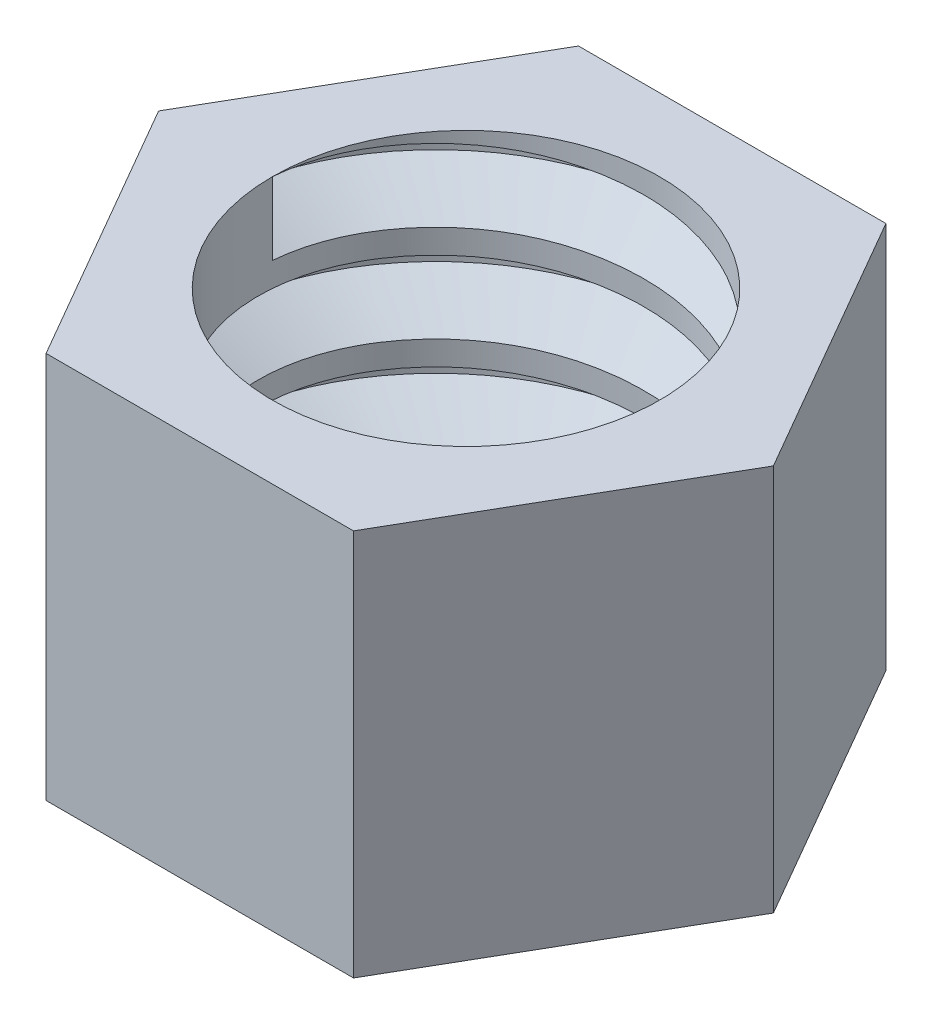
from build123d import *

# Parameters (mm, degrees)
SKETCH1_R           = 2.54
BOSS_EXTRUDE1_DEPTH = 2.54
THREAD2_PITCH       = 1.27


with BuildPart() as part:
    # Sketch1 → Boss-Extrude1 (new, symmetric)
    with BuildSketch(Plane(origin=(0, 0, 0), x_dir=(1, 0, 0), z_dir=(0, 1, 0))):
        Polygon((2.016395815, -3.4925), (4.03279163, 0), (2.016395815, 3.4925), (-2.016395815, 3.4925), (-4.03279163, 0), (-2.016395815, -3.4925), align=None)
        with Locations(Location((0, 0, 0), (0, 0, 270))):
            Circle(SKETCH1_R, mode=Mode.SUBTRACT)
    extrude(amount=BOSS_EXTRUDE1_DEPTH, both=True)

    # Thread2: the profile of Thread Profile2 profile screwed along a right-hand helix of 7.874016 turns, 8 arcs to a turn; built about Z, then put on its axis
    thread2_z = Axis((0, 0, 0), (0, 0, 1))
    thread2_corners = [(2.5397, 0, -0.000173205), (3.227407661, 0, 0.396874998), (3.227407661, 0, 0.555624998), (2.5397, 0, 0.952673202)]
    with BuildLine(mode=Mode.PRIVATE) as thread2_profile:
        Line(thread2_corners[0], thread2_corners[1])
        Line(thread2_corners[1], thread2_corners[2])
        Line(thread2_corners[2], thread2_corners[3])
        Line(thread2_corners[3], thread2_corners[0])
    thread2_cap = Face(thread2_profile.wire())
    thread2_turn_angles = [0, 22.5, 45, 67.5, 90, 112.5, 135, 157.5, 180, 202.5, 225, 247.5, 270, 292.5, 315, 337.5, 360]
    thread2_turn_weights = [1, 0.9238795325112867, 1, 0.9238795325112867, 1, 0.9238795325112867, 1, 0.9238795325112867, 1, 0.9238795325112867, 1, 0.9238795325112867, 1, 0.9238795325112867, 1, 0.9238795325112867, 1]
    thread2_turn_rails = [Edge.make_bspline([Vector(p[0], p[1], 0).rotate(thread2_z, thread2_turn_angles[k]) / thread2_turn_weights[k] + Vector(0, 0, p[2] + THREAD2_PITCH * thread2_turn_angles[k] / 360) for k in range(17)], [0, 0, 0, 1, 1, 2, 2, 3, 3, 4, 4, 5, 5, 6, 6, 7, 7, 8, 8, 8], 2, thread2_turn_weights) for p in thread2_corners]
    thread2_turn_sides = [Face.make_surface_from_curves(thread2_turn_rails[p[0]], thread2_turn_rails[p[1]]) for p in [(0, 1), (1, 2), (2, 3), (3, 0)]]
    thread2_last_angles = [2520, 2542.5, 2565, 2587.5, 2610, 2632.5, 2655, 2677.5, 2700, 2722.5, 2745, 2767.5, 2790, 2812.322834646, 2834.645669291]
    thread2_last_weights = [1, 0.9238795325112867, 1, 0.9238795325112867, 1, 0.9238795325112867, 1, 0.9238795325112867, 1, 0.9238795325112867, 1, 0.9238795325112867, 1, 0.9250584165493104, 1]
    thread2_last_rails = [Edge.make_bspline([Vector(p[0], p[1], 0).rotate(thread2_z, thread2_last_angles[k]) / thread2_last_weights[k] + Vector(0, 0, p[2] + THREAD2_PITCH * thread2_last_angles[k] / 360) for k in range(15)], [0, 0, 0, 1, 1, 2, 2, 3, 3, 4, 4, 5, 5, 6, 6, 7, 7, 7], 2, thread2_last_weights) for p in thread2_corners]
    thread2_last_sides = [Face.make_surface_from_curves(thread2_last_rails[p[0]], thread2_last_rails[p[1]]) for p in [(0, 1), (1, 2), (2, 3), (3, 0)]]
    thread2 = Plane(origin=(0, 2.54, 0), x_dir=(-1, 0, 0), z_dir=(0, -1, 0)) * Solid(Shell([*[p.moved(Location((0, 0, THREAD2_PITCH * i))) for i in range(7) for p in thread2_turn_sides], *thread2_last_sides, thread2_cap, thread2_cap.rotate(thread2_z, 2834.645669291).moved(Location((0, 0, THREAD2_PITCH * 2834.645669291 / 360)))]))
    add(thread2, mode=Mode.SUBTRACT)


solid = part.part
